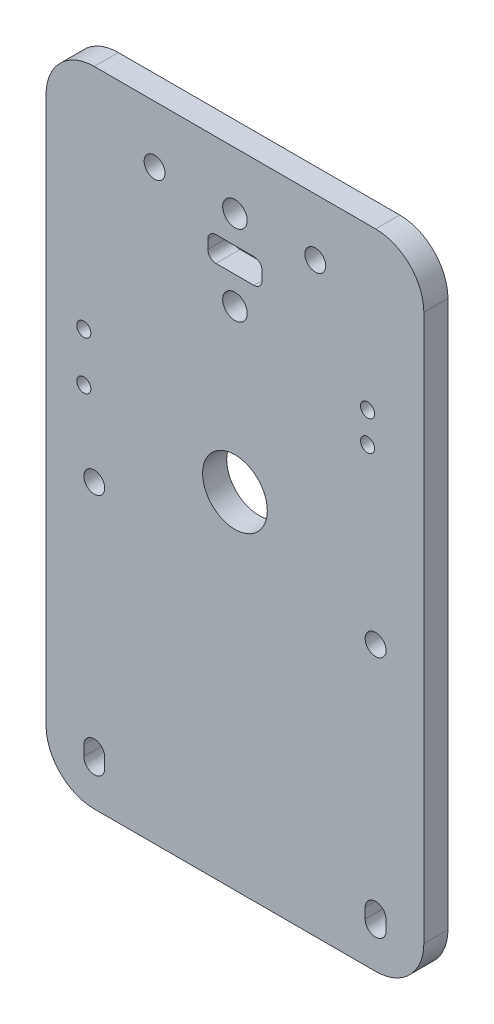
from build123d import *

# Parameters (mm, degrees)
MODEL_R           = 2.6
MODEL_R_2         = 3.05
MODEL_W           = 13.5
MODEL_H           = 6.2
BASE_DEPTH        = 6
SKETCH_1_R        = 8.05
BEARINGHOLE_DEPTH = 10
SKETCH1_R         = 1.75
SENSORMOUNT_DEPTH = 10
SKETCH3_R         = 1.75
CABLEMOUNT_DEPTH  = 10
FILLETCABLESLOT_R = 2


with BuildPart() as part:
    # Model → Base (new body)
    with BuildSketch(Plane.XY):
        with BuildLine():
            Line((35, 160), (-35, 160))
            ThreePointArc((-35, 160), (-43.485281374, 156.485281374), (-47, 148))
            Line((-47, 148), (-47, 12))
            ThreePointArc((-47, 12), (-43.485281374, 3.514718626), (-35, 0))
            Line((-35, 0), (35, 0))
            ThreePointArc((35, 0), (43.485281374, 3.514718626), (47, 12))
            Line((47, 12), (47, 148))
            ThreePointArc((47, 148), (43.485281374, 156.485281374), (35, 160))
        make_face()
        with BuildLine():
            ThreePointArc((-37.6, 12.5), (-35, 15.1), (-32.4, 12.5))
            Line((-32.4, 12.5), (-32.4, 10))
            ThreePointArc((-32.4, 10), (-35, 7.4), (-37.6, 10))
            Line((-37.6, 10), (-37.6, 12.5))
        make_face(mode=Mode.SUBTRACT)
        with Locations((-35, 70.45)):
            Circle(MODEL_R, mode=Mode.SUBTRACT)
        with BuildLine():
            Line((32.4, 10), (32.4, 12.5))
            ThreePointArc((32.4, 12.5), (35, 15.1), (37.6, 12.5))
            Line((37.6, 12.5), (37.6, 10))
            ThreePointArc((37.6, 10), (35, 7.4), (32.4, 10))
        make_face(mode=Mode.SUBTRACT)
        with Locations((35, 70.45)):
            Circle(MODEL_R, mode=Mode.SUBTRACT)
        with Locations((-20, 145.8)):
            Circle(MODEL_R, mode=Mode.SUBTRACT)
        with Locations((0, 125.8)):
            Circle(MODEL_R_2, mode=Mode.SUBTRACT)
        with Locations((0, 135.8)):
            Rectangle(MODEL_W, MODEL_H, mode=Mode.SUBTRACT)
        with Locations((0, 145.8)):
            Circle(MODEL_R_2, mode=Mode.SUBTRACT)
        with Locations((20, 145.8)):
            Circle(MODEL_R, mode=Mode.SUBTRACT)
    extrude(amount=BASE_DEPTH)

    # Эскиз1 → BearingHole (cut)
    with BuildSketch(Plane(origin=(0, 0, 0), x_dir=(-1, 0, 0), z_dir=(0, 0, -1))):
        with Locations((0, 85.8)):
            Circle(SKETCH_1_R)
    extrude(amount=-BEARINGHOLE_DEPTH, mode=Mode.SUBTRACT)

    # Sketch1 → SensorMount (cut)
    with BuildSketch(Plane.XY.offset(6)):
        with Locations((33, 120)):
            Circle(SKETCH1_R)
        with Locations((33, 112.5)):
            Circle(SKETCH1_R)
    extrude(amount=-SENSORMOUNT_DEPTH, mode=Mode.SUBTRACT)

    # Sketch3 → CableMount (cut)
    with BuildSketch(Plane(origin=(0, 0, 0), x_dir=(-1, 0, 0), z_dir=(0, 0, -1))):
        with Locations((37.6, 90.08855339)):
            Circle(SKETCH3_R)
        with Locations((37.6, 102.08855339)):
            Circle(SKETCH3_R)
    extrude(amount=-CABLEMOUNT_DEPTH, mode=Mode.SUBTRACT)

    # FilletCableSlot
    filletcableslot_edges = [part.edges().sort_by_distance(p)[0] for p in [
        (6.75, 138.9, 3),
        (-6.75, 138.9, 3),
        (-6.75, 132.7, 3),
        (6.75, 132.7, 3),
    ]]
    fillet(filletcableslot_edges, radius=FILLETCABLESLOT_R)


solid = part.part
